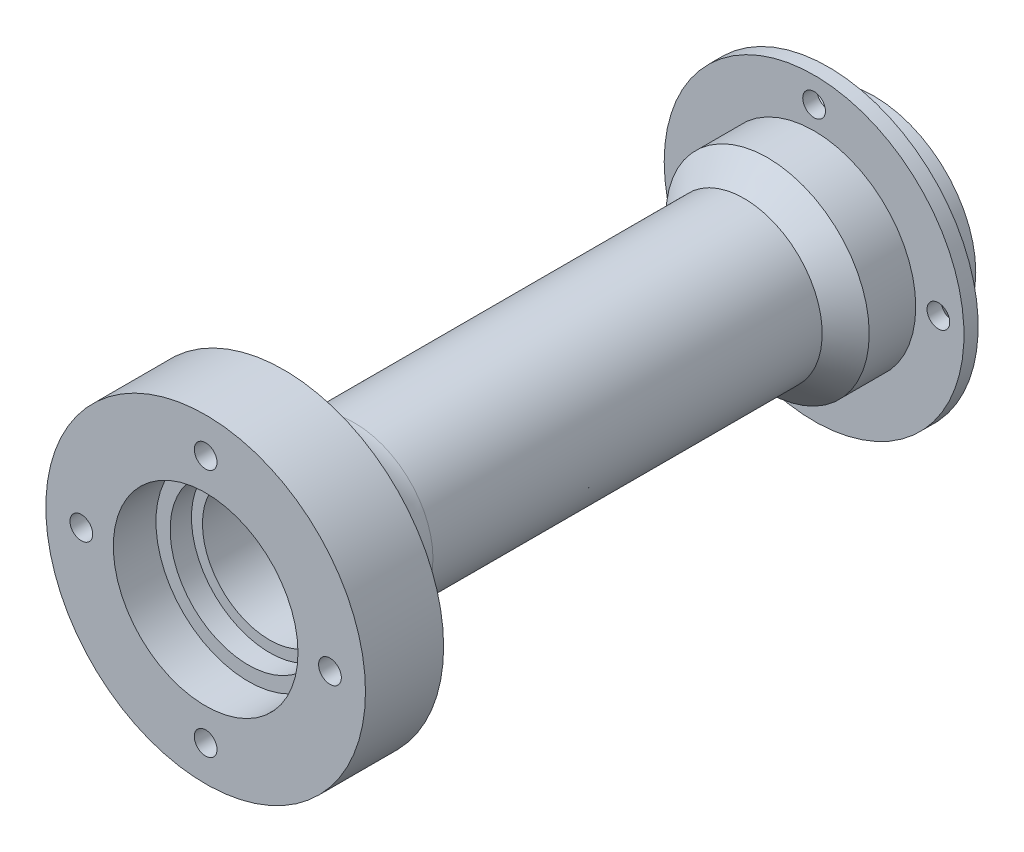
from build123d import *

# Parameters (mm, degrees)
SKETCH2_R               = 11
SKETCH2_R_2             = 9.45
BOSS_EXTRUDE2_DEPTH     = 88.1
BOSS_EXTRUDE3_START     = -5
SKETCH3_R               = 22.5
SKETCH3_R_2             = 11
BOSS_EXTRUDE3_DEPTH     = 5
FILLET1_R               = 10
CUT_EXTRUDE1_START      = -3
SKETCH4_R               = 11
SKETCH4_R_2             = 9.45
CUT_EXTRUDE1_DEPTH      = 3
SKETCH7_R               = 14.31
SKETCH7_R_2             = 11
BOSS_EXTRUDE6_DEPTH     = 20
SKETCH8_R               = 11
CUT_EXTRUDE3_DEPTH      = 7
SKETCH10_R              = 21.1
SKETCH10_R_2            = 14.31
BOSS_EXTRUDE8_DEPTH     = 2
CUT_EXTRUDE4_DEPTH      = 88.631173106
CUT_EXTRUDE4_DEPTH_BACK = 2
SKETCH11_R              = 1.6
CHAMFER5_SIZE           = 5
CUT_EXTRUDE5_START      = -10
SKETCH12_R              = 1.6
CUT_EXTRUDE5_DEPTH      = 10
SKETCH13_R              = 22.5
SKETCH13_R_2            = 13
SKETCH13_R_3            = 1.6
BOSS_EXTRUDE9_DEPTH     = 6


with BuildPart() as part:
    # Sketch2 → Boss-Extrude2 (new body)
    with BuildSketch(Plane.XY):
        Circle(SKETCH2_R)
        Circle(SKETCH2_R_2, mode=Mode.SUBTRACT)
    extrude(amount=BOSS_EXTRUDE2_DEPTH)

    # Sketch3 → Boss-Extrude3 (add)
    with BuildSketch(Plane.XY.offset(88.1).offset(BOSS_EXTRUDE3_START)):
        Circle(SKETCH3_R)
        Circle(SKETCH3_R_2, mode=Mode.SUBTRACT)
    extrude(amount=BOSS_EXTRUDE3_DEPTH)

    # Fillet1
    fillet1_edges = [part.edges().sort_by_distance(p)[0] for p in [
        (-11, 0, 83.1),
    ]]
    fillet(fillet1_edges, radius=FILLET1_R)

    # Sketch4 → Cut-Extrude1 (cut)
    with BuildSketch(Plane.XY.offset(88.1).offset(CUT_EXTRUDE1_START)):
        Circle(SKETCH4_R)
        Circle(SKETCH4_R_2, mode=Mode.SUBTRACT)
    extrude(amount=CUT_EXTRUDE1_DEPTH, mode=Mode.SUBTRACT)

    # Sketch7 → Boss-Extrude6 (add)
    with BuildSketch(Plane(origin=(0, 0, 0), x_dir=(-1, 0, 0), z_dir=(0, 0, -1))):
        Circle(SKETCH7_R)
        Circle(SKETCH7_R_2, mode=Mode.SUBTRACT)
    extrude(amount=-BOSS_EXTRUDE6_DEPTH)

    # Sketch8 → Cut-Extrude3 (cut)
    with BuildSketch(Plane(origin=(0, 0, 0), x_dir=(-1, 0, 0), z_dir=(0, 0, -1))):
        Circle(SKETCH8_R)
    extrude(amount=-CUT_EXTRUDE3_DEPTH, mode=Mode.SUBTRACT)

    # Sketch10 → Boss-Extrude8 (add)
    with BuildSketch(Plane(origin=(0, 0, 6.45), x_dir=(-1, 0, 0), z_dir=(0, 0, -1))):
        Circle(SKETCH10_R)
        Circle(SKETCH10_R_2, mode=Mode.SUBTRACT)
    extrude(amount=-BOSS_EXTRUDE8_DEPTH)

    # Sketch11 → Cut-Extrude4 (cut, two sides: drawn at the far end of the back side and taken through both)
    with BuildSketch(Plane(origin=(0, 0, 6.45), x_dir=(-1, 0, 0), z_dir=(0, 0, -1)).offset(-CUT_EXTRUDE4_DEPTH_BACK)):
        with Locations((0, 17.5)):
            Circle(SKETCH11_R)
        with Locations((17, 0)):
            Circle(SKETCH11_R)
        with Locations((-0.5, -17)):
            Circle(SKETCH11_R)
        with Locations((-17.5, 0.5)):
            Circle(SKETCH11_R)
    extrude(amount=CUT_EXTRUDE4_DEPTH + CUT_EXTRUDE4_DEPTH_BACK, mode=Mode.SUBTRACT)

    # Chamfer5
    # the kernel refuses this chamfer: 5 mm, written as the material it takes off along each edge
    with BuildSketch(Plane(origin=(0, 0, 20), x_dir=(-1, 0, 0), z_dir=(0, -1, 0))) as chamfer5_piece_1_section:
        Polygon((14.31 - CHAMFER5_SIZE, 0), (14.31, CHAMFER5_SIZE), (14.31, 0), align=None)
    chamfer5_piece_1 = revolve(axis=Axis((0, 0, 20), (0, 0, -1)), mode=Mode.PRIVATE)
    chamfer5_piece_1 = chamfer5_piece_1 - Plane(origin=(0, 0, 16.654544166), x_dir=(1, 0, 0), z_dir=(0, 0, -1)) * Cylinder(11, 58, mode=Mode.PRIVATE)
    add(chamfer5_piece_1, mode=Mode.SUBTRACT)

    # Sketch12 → Cut-Extrude5 (cut)
    with BuildSketch(Plane.XY.offset(88.1).offset(CUT_EXTRUDE5_START)):
        with Locations(Location((0, 17.5, 0), (0, 0, 180))):
            Circle(SKETCH12_R)
        with Locations((17.5, 0)):
            Circle(SKETCH12_R)
        with Locations((0, -17.5)):
            Circle(SKETCH12_R)
        with Locations((-17.5, 0)):
            Circle(SKETCH12_R)
    extrude(amount=CUT_EXTRUDE5_DEPTH, mode=Mode.SUBTRACT)

    # Sketch13 → Boss-Extrude9 (add)
    with BuildSketch(Plane.XY.offset(88.1)):
        Circle(SKETCH13_R)
        Circle(SKETCH13_R_2, mode=Mode.SUBTRACT)
        with Locations((-17.5, 0)):
            Circle(SKETCH13_R_3, mode=Mode.SUBTRACT)
        with Locations((17.5, 0)):
            Circle(SKETCH13_R_3, mode=Mode.SUBTRACT)
        with Locations((0, -17.5)):
            Circle(SKETCH13_R_3, mode=Mode.SUBTRACT)
        with Locations(Location((0, 17.5, 0), (0, 0, 180))):
            Circle(SKETCH13_R_3, mode=Mode.SUBTRACT)
    extrude(amount=BOSS_EXTRUDE9_DEPTH)


solid = part.part
